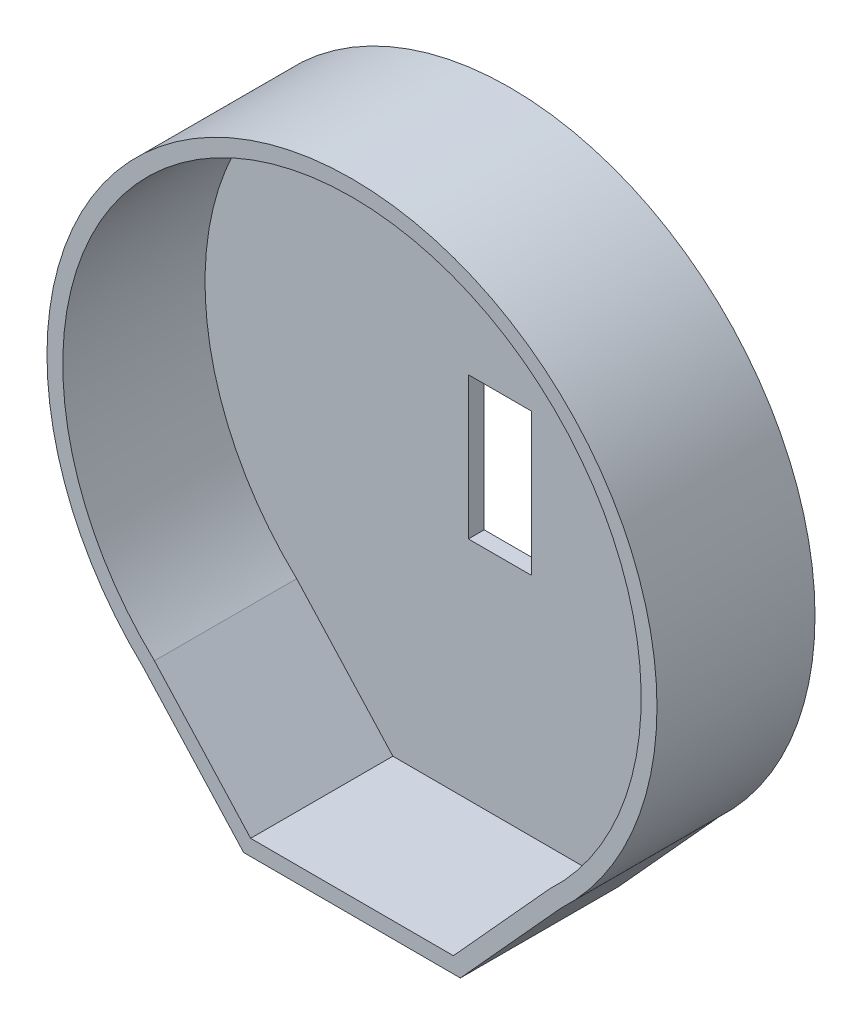
from build123d import *

# Parameters (mm, degrees)
BOSS_EXTRUDE1_DEPTH = 10
SHELL1_START        = 1
SHELL1_DEPTH        = 9
CUT_EXTRUDE1_REACH  = 40.243
SKETCH2_W           = 4
SKETCH2_H           = 9


# Read off the part's stored shape, not the designer's step: Shell1
with BuildPart() as part:
    # Sketch1 → Boss-Extrude1 (new body)
    with BuildSketch(Plane.XY):
        with BuildLine():
            Line((-17.310520711, -21.823889376), (-3.597740248, -21.843555797))
            Line((-3.597740248, -21.843555797), (2.757908107, -14.842465178))
            ThreePointArc((2.757908107, -14.842465178), (-10.455115829, 18.525441507), (-23.668139764, -14.842465178))
            Line((-23.668139764, -14.842465178), (-17.310520711, -21.823889376))
        make_face()
    extrude(amount=BOSS_EXTRUDE1_DEPTH)

    # Shell1 outline → Shell1 (cut)
    with BuildSketch(Plane.XY.offset(SHELL1_START)):
        with BuildLine():
            Line((-4.039953619, -20.84292056), (2.044621953, -14.140431281))
            ThreePointArc((2.044621953, -14.140431281), (-10.45473176, 17.525441503), (-22.955414629, -14.139906596))
            Line((-22.955414629, -14.139906596), (-16.868083072, -20.824522877))
            Line((-16.868083072, -20.824522877), (-4.039953619, -20.84292056))
        make_face()
    extrude(amount=SHELL1_DEPTH, mode=Mode.SUBTRACT)

    # Sketch2 → Cut-Extrude1 (cut, up to next)
    with BuildSketch(Plane.XY.offset(10), mode=Mode.PRIVATE) as cut_extrude1_sk1:
        with Locations((-10.090473375, -2.029514736)):
            Rectangle(SKETCH2_W, SKETCH2_H)
    cut_extrude1_tool1 = extrude(cut_extrude1_sk1.sketch, amount=-CUT_EXTRUDE1_REACH, mode=Mode.PRIVATE) & part.part
    add(cut_extrude1_tool1.solids().sort_by_distance((-10.090473, -2.029515, 10))[0], mode=Mode.SUBTRACT)


solid = part.part
